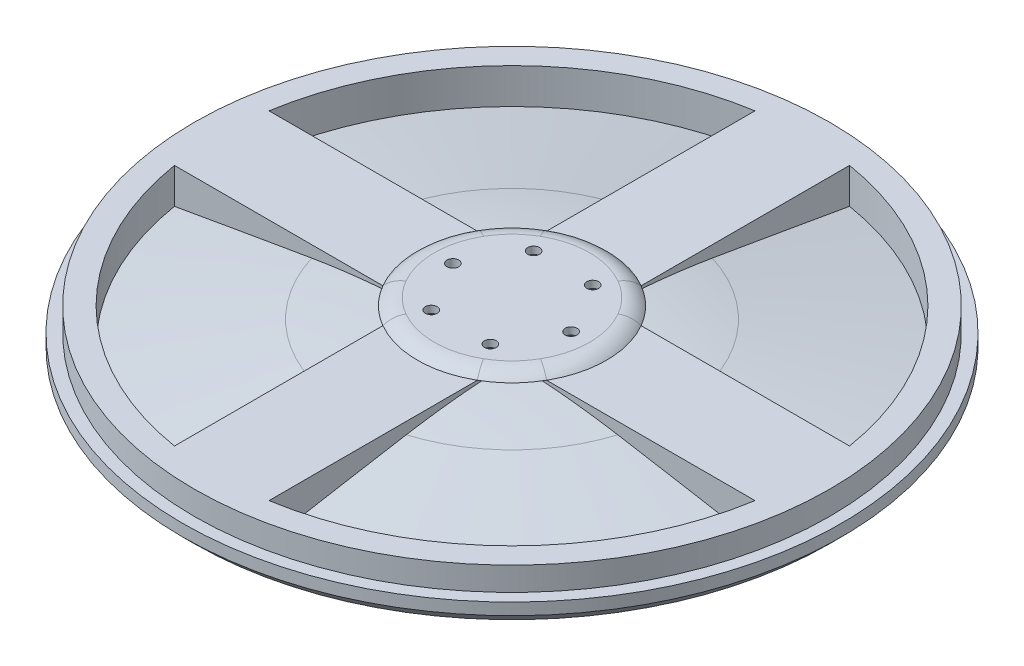
from build123d import *

# Parameters (mm, degrees)
SKETCH_1_R               = 13.945
EXTRUDE_1_DEPTH          = 0.5
SKETCH_7_R               = 1
CUT_EXTRUDE_6_DEPTH      = 0.3
SKETCH_8_R               = 13.945
SKETCH_8_R_2             = 12.445
EXTRUDE_3_DEPTH          = 0.5
SKETCH_9_R               = 13.445
SKETCH_9_R_2             = 12.445
EXTRUDE_4_DEPTH          = 1
CHAMFER_1_SIZE           = 0.5
SKETCH_10_R              = 4
EXTRUDE_5_DEPTH          = 1.5
FILLET_5_R               = 32
SKETCH_13_W              = 10.517366369
SKETCH_13_H              = 4
SKETCH_13_W_2            = 4
SKETCH_13_H_2            = 10.517366369
EXTRUDE_8_DEPTH          = 2
SKETCH_15_R              = 4
EXTRUDE_9_DEPTH          = 0.3
FILLET_6_R               = 1
SKETCH_16_R              = 0.25
CUT_EXTRUDE_7_DEPTH      = 1
PATTERN_CIRCULAR_1_COUNT = 6


with BuildPart() as part:
    # 草图1 → 凸台-拉伸1 (new body)
    with BuildSketch(Plane(origin=(0, 0, 0), x_dir=(1, 0, 0), z_dir=(0, 1, 0))):
        with Locations(Location((0, 0, 0), (0, 0, 270))):
            Circle(SKETCH_1_R)
    extrude(amount=EXTRUDE_1_DEPTH)

    # 草图7 → 切除-拉伸6 (cut)
    with BuildSketch(Plane(origin=(0, 0.5, 0), x_dir=(1, 0, 0), z_dir=(0, 1, 0))):
        with Locations(Location((0, 0, 0), (0, 0, 270))):
            Circle(SKETCH_7_R)
    extrude(amount=-CUT_EXTRUDE_6_DEPTH, mode=Mode.SUBTRACT)

    # 草图8 → 凸台-拉伸3 (add)
    with BuildSketch(Plane(origin=(0, 0.5, 0), x_dir=(1, 0, 0), z_dir=(0, 1, 0))):
        with Locations(Location((0, 0, 0), (0, 0, 270))):
            Circle(SKETCH_8_R)
        with Locations(Location((0, 0, 0), (0, 0, 270))):
            Circle(SKETCH_8_R_2, mode=Mode.SUBTRACT)
    extrude(amount=EXTRUDE_3_DEPTH)

    # 草图9 → 凸台-拉伸4 (add)
    with BuildSketch(Plane(origin=(0, 1, 0), x_dir=(1, 0, 0), z_dir=(0, 1, 0))):
        with Locations(Location((0, 0, 0), (0, 0, 270))):
            Circle(SKETCH_9_R)
        with Locations(Location((0, 0, 0), (0, 0, 270))):
            Circle(SKETCH_9_R_2, mode=Mode.SUBTRACT)
    extrude(amount=EXTRUDE_4_DEPTH)

    # 倒角1
    chamfer_1_edges = [part.edges().sort_by_distance(p)[0] for p in [
        (0, 0, -13.945),
    ]]
    chamfer(chamfer_1_edges, length=CHAMFER_1_SIZE)

    # 草图10 → 凸台-拉伸5 (add)
    with BuildSketch(Plane(origin=(0, 0.5, 0), x_dir=(1, 0, 0), z_dir=(0, 1, 0))):
        with Locations(Location((0, 0, 0), (0, 0, 270))):
            Circle(SKETCH_10_R)
    extrude(amount=EXTRUDE_5_DEPTH)

    # loft up to a face of the part (loft_1)
    loft([Face(Wire([part.edges().sort_by_distance((9.072014568, 0.5, -8.519188733))[0]])), Face(Wire([part.edges().sort_by_distance((2.91587451, 2, -2.738188424))[0]]))])

    # 圆角5
    fillet_5_edges = [part.edges().sort_by_distance(p)[0] for p in [
        (0, 2, -4),
    ]]
    fillet(fillet_5_edges, radius=FILLET_5_R)

    # 草图13 → 凸台-拉伸8 (add)
    with BuildSketch(Plane.XZ):
        with Locations((7.751371618, 0)):
            Rectangle(SKETCH_13_W, SKETCH_13_H)
        with Locations((0, 7.751371618)):
            Rectangle(SKETCH_13_W_2, SKETCH_13_H_2)
        with Locations((0, -7.751371618)):
            Rectangle(SKETCH_13_W_2, SKETCH_13_H_2)
        with Locations((-7.751371618, 0)):
            Rectangle(SKETCH_13_W, SKETCH_13_H)
    extrude(amount=-EXTRUDE_8_DEPTH)

    # 草图15 → 凸台-拉伸9 (add)
    with BuildSketch(Plane(origin=(0, 2, 0), x_dir=(1, 0, 0), z_dir=(0, 1, 0))):
        with Locations(Location((0, 0, 0), (0, 0, 60))):
            Circle(SKETCH_15_R)
    extrude(amount=EXTRUDE_9_DEPTH)

    # 圆角6
    # the kernel refuses this fillet: 1 mm, written as the material it takes off along each edge
    with BuildSketch(Plane(origin=(0, 2.3, 0), x_dir=(0.5000000000000001, 0, -0.8660254037844386), z_dir=(0.8660254037844386, 0, 0.5000000000000001))) as fillet_6_piece_1:
        with BuildLine():
            CenterArc((3.285857157, -1), FILLET_6_R, 44.427004001, 45.572995999)
            Line((3.285857157, 0), (3.285857157, 0.02))
            Line((3.285857157, 0.02), (4, 0.02))
            Line((4, 0.02), (4.02, 0))
            ThreePointArc((4.02, 0), (4.02, -0.15), (4.014282857, -0.286))
            Line((4.014282857, -0.286), (4, -0.3))
        make_face()
    revolve(axis=Axis((0, 2.3, 0), (0, 1, 0)), mode=Mode.SUBTRACT)

    # 草图16 → 切除-拉伸7 (cut)
    with BuildSketch(Plane(origin=(0, 2.3, 0), x_dir=(1, 0, 0), z_dir=(0, 1, 0))):
        with Locations(Location((2.5, 0, 0), (0, 0, 270))):
            Circle(SKETCH_16_R)
    cut_extrude_7 = extrude(amount=-CUT_EXTRUDE_7_DEPTH, mode=Mode.SUBTRACT)

    # 阵列(圆周)1: 切除-拉伸7 ×6 about axis
    pattern_circular_1_axis = Axis((0, 0, 0), (0, 1, 0))
    for i in range(1, PATTERN_CIRCULAR_1_COUNT):
        add(cut_extrude_7.rotate(pattern_circular_1_axis, i * 360 / PATTERN_CIRCULAR_1_COUNT), mode=Mode.SUBTRACT)


solid = part.part
